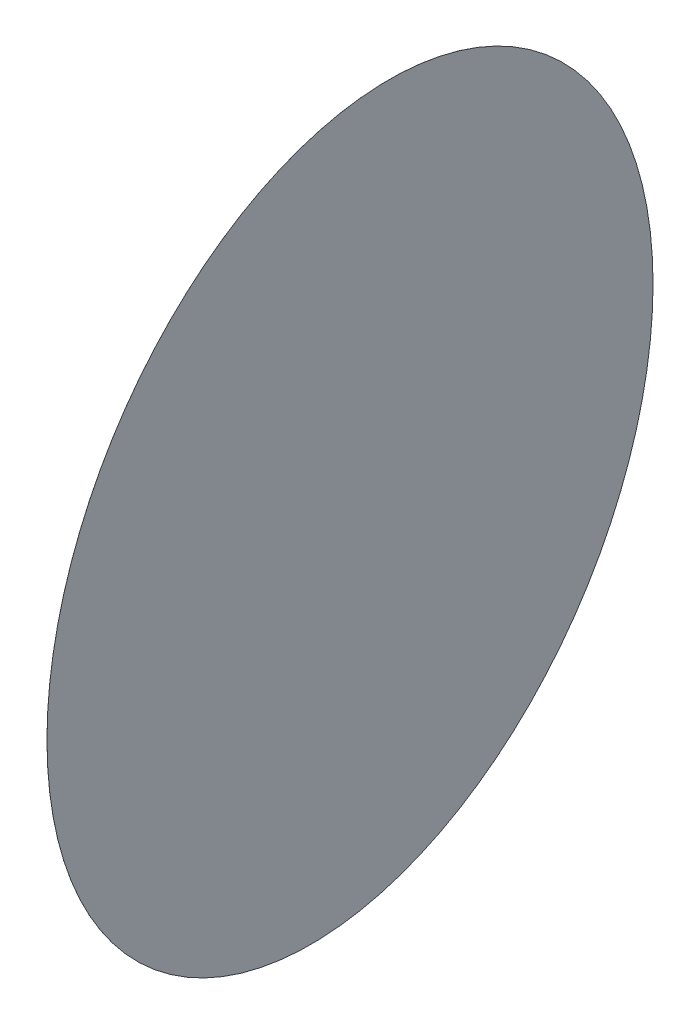
from build123d import *

# Parameters (mm, degrees)
SKETCH_1_R      = 15
EXTRUDE_1_DEPTH = 0.001


with BuildPart() as part:
    # 草图1 → 凸台-拉伸1 (new body)
    with BuildSketch(Plane(origin=(39.657794455, 0, -5.221047689), x_dir=(0.13052619222005202, 0, 0.9914448613738104), z_dir=(-0.9914448613738104, 0, 0.13052619222005202))):
        Circle(SKETCH_1_R)
    extrude(amount=-EXTRUDE_1_DEPTH)


solid = part.part
